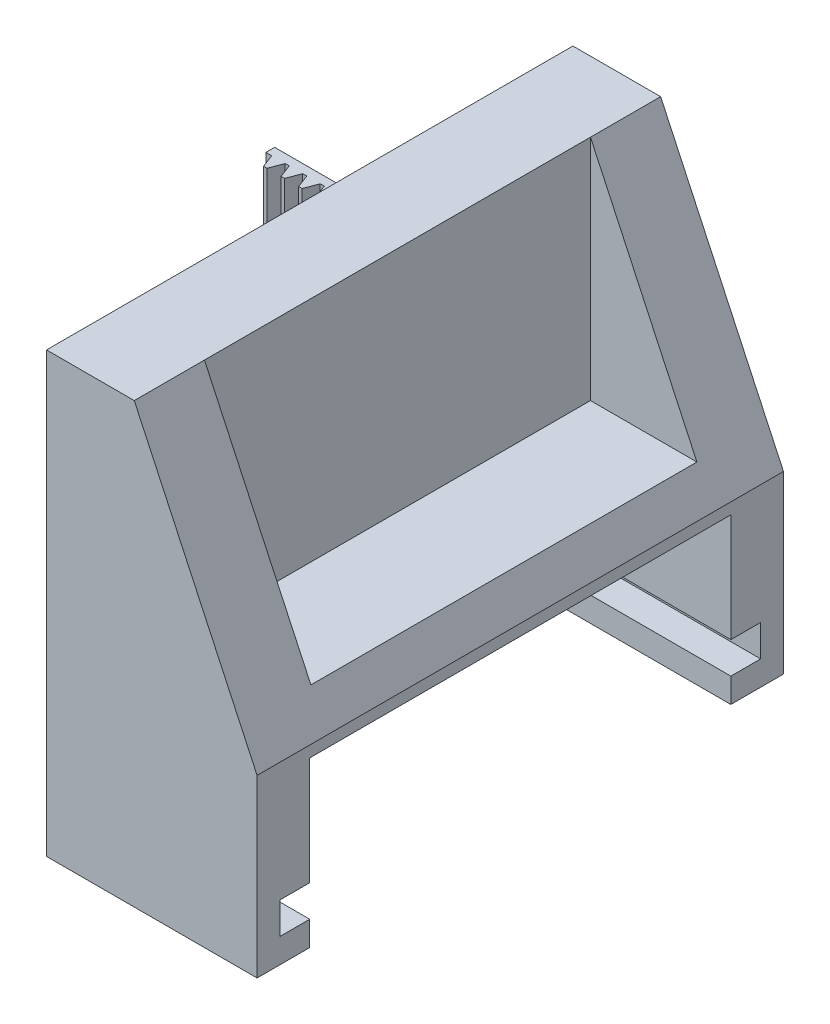
from build123d import *

# Parameters (mm, degrees)
BOSS_EXTRUDE1_DEPTH = 30
SKETCH4_W           = 24
SKETCH4_H           = 14
CUT_EXTRUDE2_DEPTH  = 25
SKETCH5_W           = 1.7
SKETCH5_H           = 1.8
CUT_EXTRUDE3_DEPTH  = 15
CUT_EXTRUDE4_DEPTH  = 11
BOSS_EXTRUDE2_DEPTH = 4


with BuildPart() as part:
    # Sketch1 → Boss-Extrude1 (new body)
    with BuildSketch(Plane.XY):
        Polygon((0, 0), (0, -25), (12, -25), (12, -15), (5, 0), align=None)
    extrude(amount=-BOSS_EXTRUDE1_DEPTH)

    # Sketch4 → Cut-Extrude2 (cut)
    with BuildSketch(Plane.ZY):
        with Locations((-15, -22.638599401)):
            Rectangle(SKETCH4_W, SKETCH4_H)
    extrude(amount=-CUT_EXTRUDE2_DEPTH, mode=Mode.SUBTRACT)

    # Sketch5 → Cut-Extrude3 (cut)
    with BuildSketch(Plane.ZY):
        with Locations((-2.15, -22.7)):
            Rectangle(SKETCH5_W, SKETCH5_H)
    cut_extrude3 = extrude(amount=-CUT_EXTRUDE3_DEPTH, mode=Mode.SUBTRACT)

    # Mirror1: Cut-Extrude3 across plane
    add(cut_extrude3.mirror(Plane.XY.offset(-15)), mode=Mode.SUBTRACT)

    # Sketch6 → Cut-Extrude4 (cut, symmetric)
    with BuildSketch(Plane.XY.offset(-15)):
        Polygon((5, 0), (5, -13), (11.066666667, -13), align=None)
    extrude(amount=CUT_EXTRUDE4_DEPTH, both=True, mode=Mode.SUBTRACT)

    # Sketch7 → Boss-Extrude2 (add)
    with BuildSketch(Plane(origin=(0, -15, 0), x_dir=(1, 0, 0), z_dir=(0, 1, 0))):
        Polygon((0, 27.5), (-14.5, 27.5), (-14.5, 27), (-14.164444468, 27), (-13.881153369, 26.251032188), (-13.681153369, 26.251032188), (-13.4, 27), (-13.164444468, 27), (-12.881153369, 26.251032188), (-12.681153369, 26.251032188), (-12.4, 27), (-12.164444468, 27), (-11.881153369, 26.251032188), (-11.681153369, 26.251032188), (-11.4, 27), (-11.164444468, 27), (-10.881153369, 26.251032188), (-10.681153369, 26.251032188), (-10.4, 27), (-10.164444468, 27), (-9.881153369, 26.251032188), (-9.681153369, 26.251032188), (-9.4, 27), (-9.164444468, 27), (-8.881153369, 26.251032188), (-8.681153369, 26.251032188), (-8.4, 27), (-8.164444468, 27), (-7.881153369, 26.251032188), (-7.681153369, 26.251032188), (-7.4, 27), (-7.164444468, 27), (-6.881153369, 26.251032188), (-6.681153369, 26.251032188), (-6.4, 27), (-6.164444468, 27), (-5.881153369, 26.251032188), (-5.681153369, 26.251032188), (-5.4, 27), (-5.164444468, 27), (-4.881153369, 26.251032188), (-4.681153369, 26.251032188), (-4.4, 27), (-4.164444468, 27), (-3.881153369, 26.251032188), (-3.681153369, 26.251032188), (-3.4, 27), (-3.164444468, 27), (-2.881153369, 26.251032188), (-2.681153369, 26.251032188), (-2.4, 27), (-2.164444468, 27), (-1.881153369, 26.251032188), (-1.681153369, 26.251032188), (-1.4, 27), (-1.164444468, 27), (-0.881153369, 26.251032188), (-0.681153369, 26.251032188), (-0.4, 27), (0, 27), align=None)
    extrude(amount=BOSS_EXTRUDE2_DEPTH)


solid = part.part
